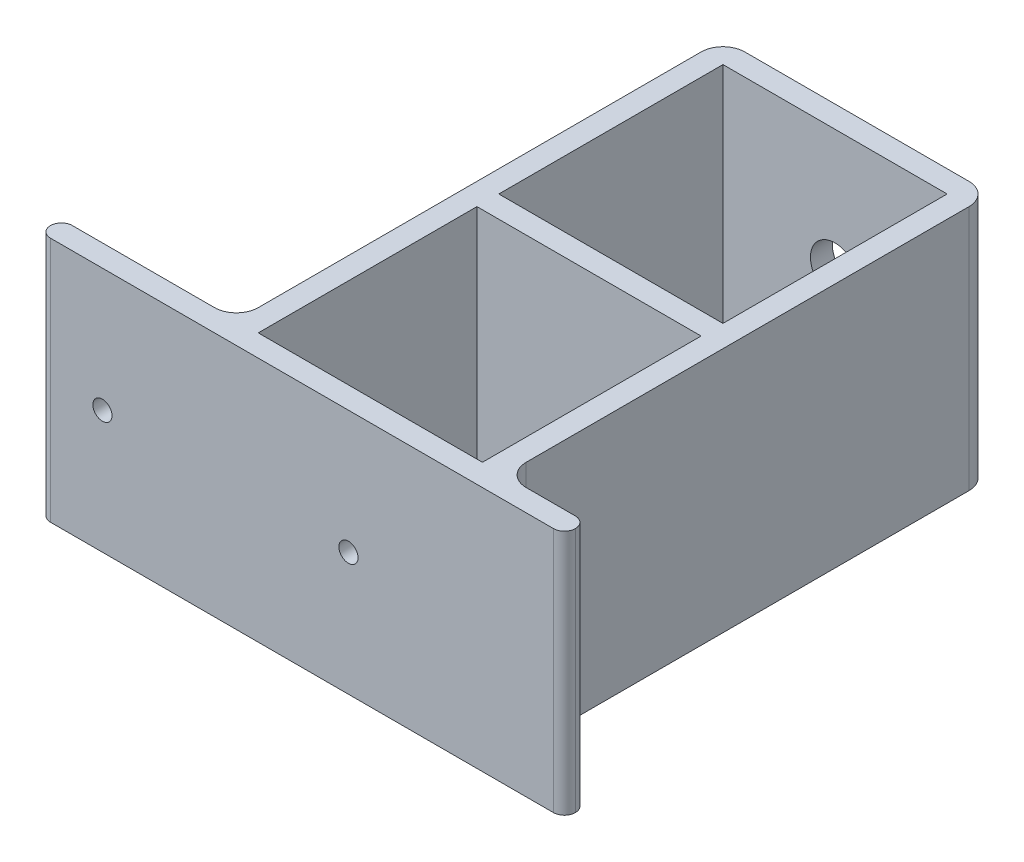
from build123d import *

# Parameters (mm, degrees)
SKETCH_1_W          = 96
SKETCH_1_H          = 45
SKETCH_1_R          = 1.75
EXTRUDE_1_DEPTH     = 4
SKETCH_2_W          = 4
SKETCH_2_H          = 45
EXTRUDE_2_DEPTH     = 85
SKETCH_3_W          = 49
SKETCH_3_H          = 45
EXTRUDE_3_DEPTH     = 4
SKETCH_4_W          = 41
SKETCH_4_H          = 4
EXTRUDE_4_DEPTH     = 45
FILLET_1_R          = 4
SKETCH_5_R          = 4.5
CUT_EXTRUDE_1_DEPTH = 4
FILLET_2_R          = 2


with BuildPart() as part:
    # 草图1 → 凸台-拉伸1 (new body)
    with BuildSketch(Plane.XY):
        Rectangle(SKETCH_1_W, SKETCH_1_H)
        with Locations((8.5, 0)):
            Circle(SKETCH_1_R, mode=Mode.SUBTRACT)
        with Locations((-36.5, 0)):
            Circle(SKETCH_1_R, mode=Mode.SUBTRACT)
    extrude(amount=EXTRUDE_1_DEPTH)

    # 草图2 → 凸台-拉伸2 (add)
    with BuildSketch(Plane(origin=(0, 0, 0), x_dir=(-1, 0, 0), z_dir=(0, 0, -1))):
        with Locations((-31, 0)):
            Rectangle(SKETCH_2_W, SKETCH_2_H)
        with Locations((14, 0)):
            Rectangle(SKETCH_2_W, SKETCH_2_H)
    extrude(amount=EXTRUDE_2_DEPTH)

    # 草图3 → 凸台-拉伸3 (add)
    with BuildSketch(Plane(origin=(0, 0, -85), x_dir=(-1, 0, 0), z_dir=(0, 0, -1))):
        with Locations((-8.5, 0)):
            Rectangle(SKETCH_3_W, SKETCH_3_H)
    extrude(amount=EXTRUDE_3_DEPTH)

    # 草图4 → 凸台-拉伸4 (add)
    with BuildSketch(Plane.XZ.offset(22.5)):
        with Locations((8.5, -42)):
            Rectangle(SKETCH_4_W, SKETCH_4_H)
    extrude(amount=-EXTRUDE_4_DEPTH)

    # 圆角1
    fillet_1_edges = [part.edges().sort_by_distance(p)[0] for p in [
        (-16, 0, 0),
        (33, 0, 0),
        (33, 0, -89),
        (-16, 0, -89),
    ]]
    fillet(fillet_1_edges, radius=FILLET_1_R)

    # 草图5 → 切除-拉伸1 (cut)
    with BuildSketch(Plane(origin=(0, 0, -89), x_dir=(-1, 0, 0), z_dir=(0, 0, -1))):
        with Locations((-8.5, 0)):
            Circle(SKETCH_5_R)
    extrude(amount=-CUT_EXTRUDE_1_DEPTH, mode=Mode.SUBTRACT)

    # 圆角2
    fillet_2_edges = [part.edges().sort_by_distance(p)[0] for p in [
        (-48, 0, 4),
        (-48, 0, 0),
        (48, 0, 4),
        (48, 0, 0),
    ]]
    fillet(fillet_2_edges, radius=FILLET_2_R - 0.0001)  # a hair under: the kernel refuses the full size


solid = part.part
